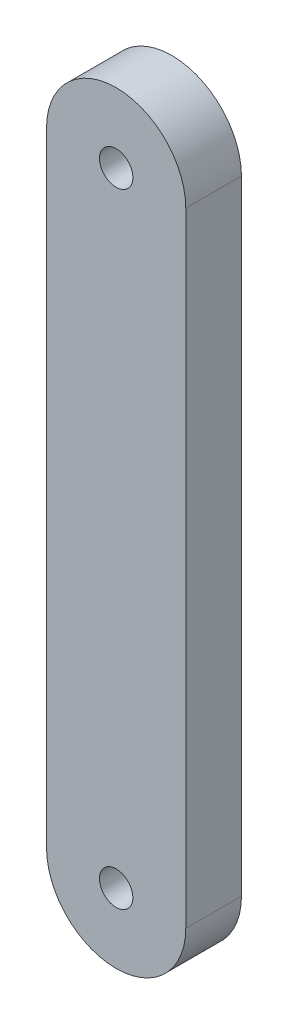
from build123d import *

# Parameters (mm, degrees)
SKETCH1_R           = 3
BOSS_EXTRUDE1_DEPTH = 10


with BuildPart() as part:
    # Sketch1 → Boss-Extrude1 (new body)
    with BuildSketch(Plane.XY):
        with BuildLine():
            Line((-12.5, 0), (-12.5, -112))
            ThreePointArc((-12.5, -112), (0, -124.5), (12.5, -112))
            Line((12.5, -112), (12.5, 0))
            ThreePointArc((12.5, 0), (0, 12.5), (-12.5, 0))
        make_face()
        Circle(SKETCH1_R, mode=Mode.SUBTRACT)
        with Locations((0, -112)):
            Circle(SKETCH1_R, mode=Mode.SUBTRACT)
    extrude(amount=BOSS_EXTRUDE1_DEPTH)


solid = part.part
